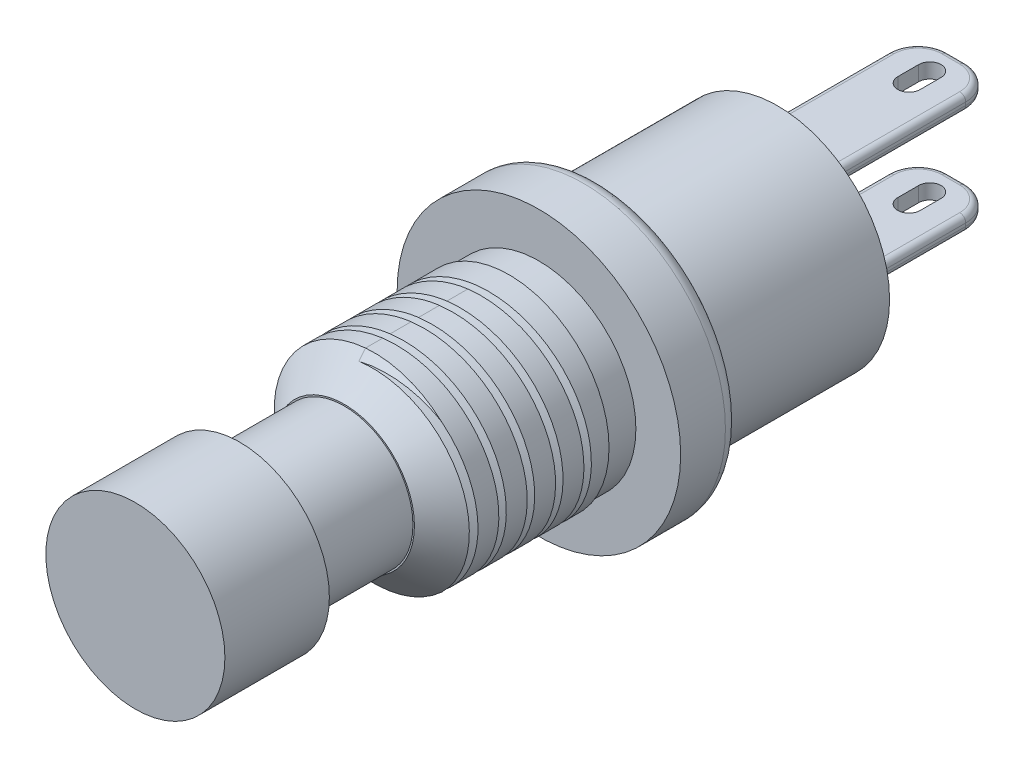
from build123d import *

# Parameters (mm, degrees)
SKETCH1_R           = 3.75
BOSS_EXTRUDE1_DEPTH = 6
SKETCH2_R           = 4.75
BOSS_EXTRUDE2_DEPTH = 2
FILLET1_R           = 0.5
SKETCH3_R           = 3.25
BOSS_EXTRUDE3_DEPTH = 1
SKETCH4_R           = 3.35
BOSS_EXTRUDE4_DEPTH = 5.52
CHAMFER1_SIZE       = 1
SKETCH5_R           = 2.3
BOSS_EXTRUDE5_DEPTH = 3.5
SKETCH6_R           = 3
BOSS_EXTRUDE6_DEPTH = 3.5
SKETCH7_W           = 2.6
SKETCH7_H           = 0.5
BOSS_EXTRUDE7_DEPTH = 6
FILLET4_R           = 1
CUT_EXTRUDE1_DEPTH  = 6
FILLET5_R           = 0.2
CUT_SWEEP1_PITCH    = 0.95
CUT_SWEEP1_HEIGHT   = 5.4625
CUT_SWEEP1_RADIUS   = 3.35


with BuildPart() as part:
    # Sketch1 → Boss-Extrude1 (new body)
    with BuildSketch(Plane.XY):
        Circle(SKETCH1_R)
    extrude(amount=BOSS_EXTRUDE1_DEPTH)

    # Sketch2 → Boss-Extrude2 (add)
    with BuildSketch(Plane.XY.offset(6)):
        Circle(SKETCH2_R)
    extrude(amount=BOSS_EXTRUDE2_DEPTH)

    # Fillet1
    fillet1_edges = [part.edges().sort_by_distance(p)[0] for p in [
        (-4.75, 0, 6),
    ]]
    fillet(fillet1_edges, radius=FILLET1_R)

    # Sketch3 → Boss-Extrude3 (add)
    with BuildSketch(Plane.XY.offset(8)):
        Circle(SKETCH3_R)
    extrude(amount=BOSS_EXTRUDE3_DEPTH)

    # Sketch4 → Boss-Extrude4 (add)
    with BuildSketch(Plane.XY.offset(9)):
        Circle(SKETCH4_R)
    extrude(amount=BOSS_EXTRUDE4_DEPTH)

    # Chamfer1
    chamfer1_edges = [part.edges().sort_by_distance(p)[0] for p in [
        (-3.35, 0, 14.52),
    ]]
    chamfer(chamfer1_edges, length=CHAMFER1_SIZE)

    # Sketch5 → Boss-Extrude5 (add)
    with BuildSketch(Plane.XY.offset(14.52)):
        Circle(SKETCH5_R)
    extrude(amount=BOSS_EXTRUDE5_DEPTH)

    # Sketch6 → Boss-Extrude6 (add)
    with BuildSketch(Plane.XY.offset(18.02)):
        Circle(SKETCH6_R)
    extrude(amount=BOSS_EXTRUDE6_DEPTH)

    # Sketch7 → Boss-Extrude7 (add)
    with BuildSketch(Plane(origin=(0, 0, 0), x_dir=(-1, 0, 0), z_dir=(0, 0, -1))):
        with Locations((0, 1.95926539)):
            Rectangle(SKETCH7_W, SKETCH7_H)
        with Locations((0, -1.550109141)):
            Rectangle(SKETCH7_W, SKETCH7_H)
    extrude(amount=BOSS_EXTRUDE7_DEPTH)

    # Fillet4
    fillet4_edges = [part.edges().sort_by_distance(p)[0] for p in [
        (1.3, 1.95926539, -6),
        (-1.3, 1.95926539, -6),
        (-1.3, -1.550109141, -6),
        (1.3, -1.550109141, -6),
    ]]
    fillet(fillet4_edges, radius=FILLET4_R)

    # Sketch8 → Cut-Extrude1 (cut)
    with BuildSketch(Plane.XZ.offset(1.800109141)):
        with BuildLine():
            Line((0.375, -4.4), (0.375, -5.1))
            ThreePointArc((0.375, -5.1), (0, -5.475), (-0.375, -5.1))
            Line((-0.375, -5.1), (-0.375, -4.4))
            ThreePointArc((-0.375, -4.4), (0, -4.025), (0.375, -4.4))
        make_face()
    extrude(amount=-CUT_EXTRUDE1_DEPTH, mode=Mode.SUBTRACT)

    # Fillet5
    fillet5_edges = [part.edges().sort_by_distance(p)[0] for p in [
        (-1.3, 2.20926539, -2.5),
        (-1.007106781, 2.20926539, -5.707106781),
        (0, 2.20926539, -6),
        (1.007106781, 2.20926539, -5.707106781),
        (-1.3, -1.300109141, -2.5),
        (-1.007106781, -1.300109141, -5.707106781),
        (0, -1.300109141, -6),
        (1.007106781, -1.300109141, -5.707106781),
        (-1.3, -1.800109141, -2.5),
        (-1.007106781, -1.800109141, -5.707106781),
        (0, -1.800109141, -6),
        (1.007106781, -1.800109141, -5.707106781),
        (1.3, 1.70926539, -2.5),
        (1.007106781, 1.70926539, -5.707106781),
        (0, 1.70926539, -6),
        (-1.007106781, 1.70926539, -5.707106781),
        (1.3, 2.20926539, -2.5),
        (1.3, -1.300109141, -2.5),
        (1.3, -1.800109141, -2.5),
        (-1.3, 1.70926539, -2.5),
    ]]
    fillet(fillet5_edges, radius=FILLET5_R)

    # Cut-Sweep1: sweep along a helix
    with BuildLine() as cut_sweep1_path:
        Helix(CUT_SWEEP1_PITCH, CUT_SWEEP1_HEIGHT, CUT_SWEEP1_RADIUS, center=(0, 0, 14.52), direction=(0, 0, -1))
    # Sketch9 → Cut-Sweep1 (sweep, cut)
    with BuildSketch(Plane(origin=(0, 0, 0), x_dir=(1, 0, 0), z_dir=(0, 1, 0))):
        Polygon((3.1, -13.52), (4.1, -13.02), (4.1, -14.02), align=None)
    sweep(path=cut_sweep1_path.line, is_frenet=True, mode=Mode.SUBTRACT)


solid = part.part
